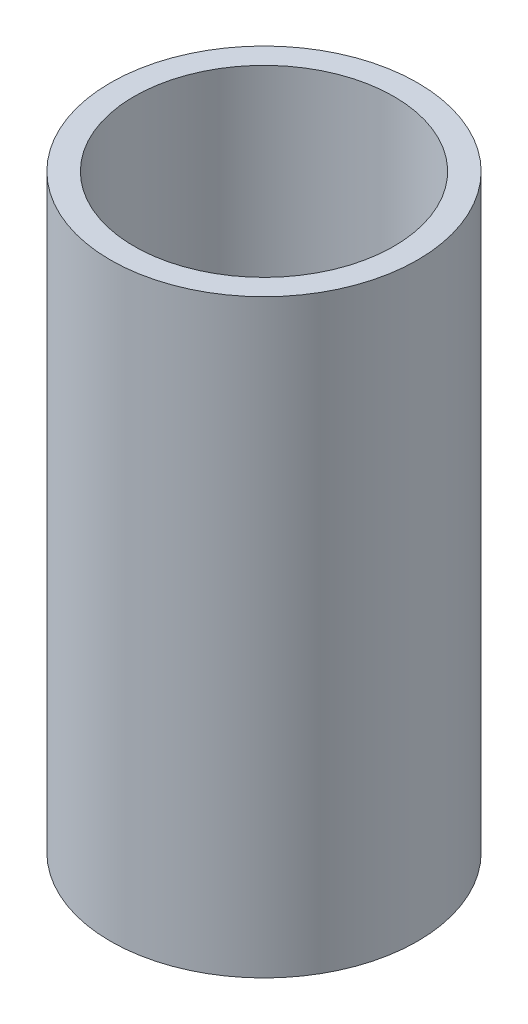
from build123d import *

# Parameters (mm, degrees)
SKETCH1_R           = 32.5
BOSS_EXTRUDE1_DEPTH = 124.881539416
SKETCH2_R           = 27.48785552
CUT_EXTRUDE1_DEPTH  = 134.07102948


with BuildPart() as part:
    # Sketch1 → Boss-Extrude1 (new body)
    with BuildSketch(Plane(origin=(0, 0, 0), x_dir=(1, 0, 0), z_dir=(0, 1, 0))):
        Circle(SKETCH1_R)
    extrude(amount=BOSS_EXTRUDE1_DEPTH)

    # Sketch2 → Cut-Extrude1 (cut, through all)
    with BuildSketch(Plane(origin=(0, 0, 0), x_dir=(1, 0, 0), z_dir=(0, 1, 0))):
        Circle(SKETCH2_R)
    extrude(amount=CUT_EXTRUDE1_DEPTH, mode=Mode.SUBTRACT)


solid = part.part
